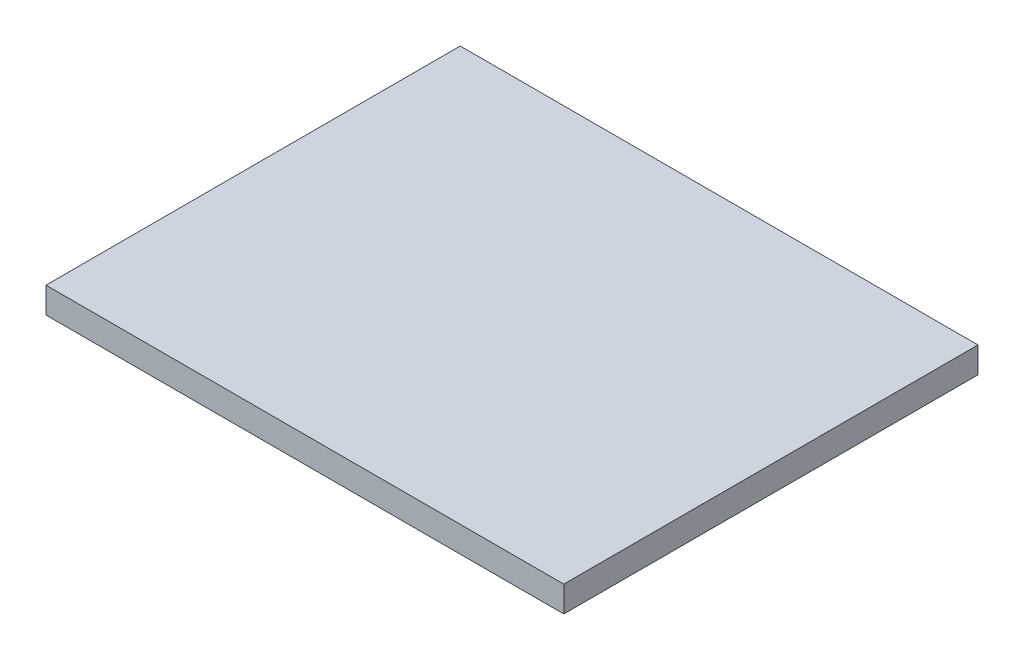
from build123d import *

# Parameters (mm, degrees)
SKIZZE1_W                       = 1000
SKIZZE1_H                       = 50
AUFSATZ_LINEAR_AUSTRAGEN1_DEPTH = 800


with BuildPart() as part:
    # Skizze1 → Aufsatz-Linear austragen1 (new body)
    with BuildSketch(Plane.XY):
        with Locations((500, 25)):
            Rectangle(SKIZZE1_W, SKIZZE1_H)
    extrude(amount=AUFSATZ_LINEAR_AUSTRAGEN1_DEPTH)


solid = part.part
